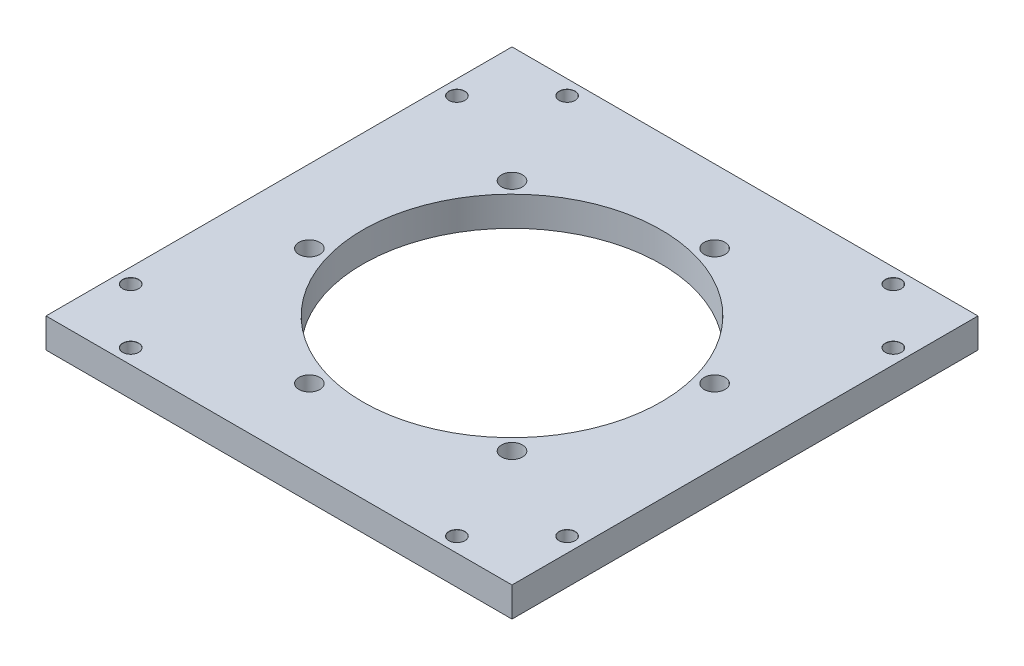
from build123d import *

# Parameters (mm, degrees)
SKETCH1_W                      = 100
SKETCH1_H                      = 100
SKETCH1_R                      = 32
BOSS_EXTRUDE3_DEPTH            = 6.35
M4_CLEARANCE_HOLE2_D           = 4.5
M4_CLEARANCE_HOLE2_CSINK_D     = 4.55
M4_CLEARANCE_HOLE2_CSINK_ANGLE = 90
M3_CLEARANCE_HOLE1_D           = 3.4
M3_CLEARANCE_HOLE1_CSINK_D     = 3.45
M3_CLEARANCE_HOLE1_CSINK_ANGLE = 90


with BuildPart() as part:
    # Sketch1 → Boss-Extrude3 (new body)
    with BuildSketch(Plane(origin=(0, 0, 0), x_dir=(1, 0, 0), z_dir=(0, 1, 0))):
        Rectangle(SKETCH1_W, SKETCH1_H)
        Circle(SKETCH1_R, mode=Mode.SUBTRACT)
    extrude(amount=BOSS_EXTRUDE3_DEPTH)

    # M4 Clearance Hole2 (through all)
    with Locations(Plane(origin=(0, 0, 0), x_dir=(-1, 0, 0), z_dir=(0, -1, 0))):
        with Locations((-9.188076101, 34.290366833), (25.102290732, 25.102290732), (34.290366833, -9.188076101), (9.188076101, -34.290366833), (-25.102290732, -25.102290732), (-34.290366833, 9.188076101)):
            CounterSinkHole(M4_CLEARANCE_HOLE2_D / 2, M4_CLEARANCE_HOLE2_CSINK_D / 2, counter_sink_angle=M4_CLEARANCE_HOLE2_CSINK_ANGLE)

    # M3 Clearance Hole1 (through all)
    with Locations(Plane(origin=(0, 6.35, 0), x_dir=(1, 0, 0), z_dir=(0, 1, 0))):
        with Locations((-46.825, 35), (-35, 46.825), (35, 46.825), (46.825, 35), (46.825, -35), (35, -46.825), (-35, -46.825), (-46.825, -35)):
            CounterSinkHole(M3_CLEARANCE_HOLE1_D / 2, M3_CLEARANCE_HOLE1_CSINK_D / 2, counter_sink_angle=M3_CLEARANCE_HOLE1_CSINK_ANGLE)


solid = part.part
